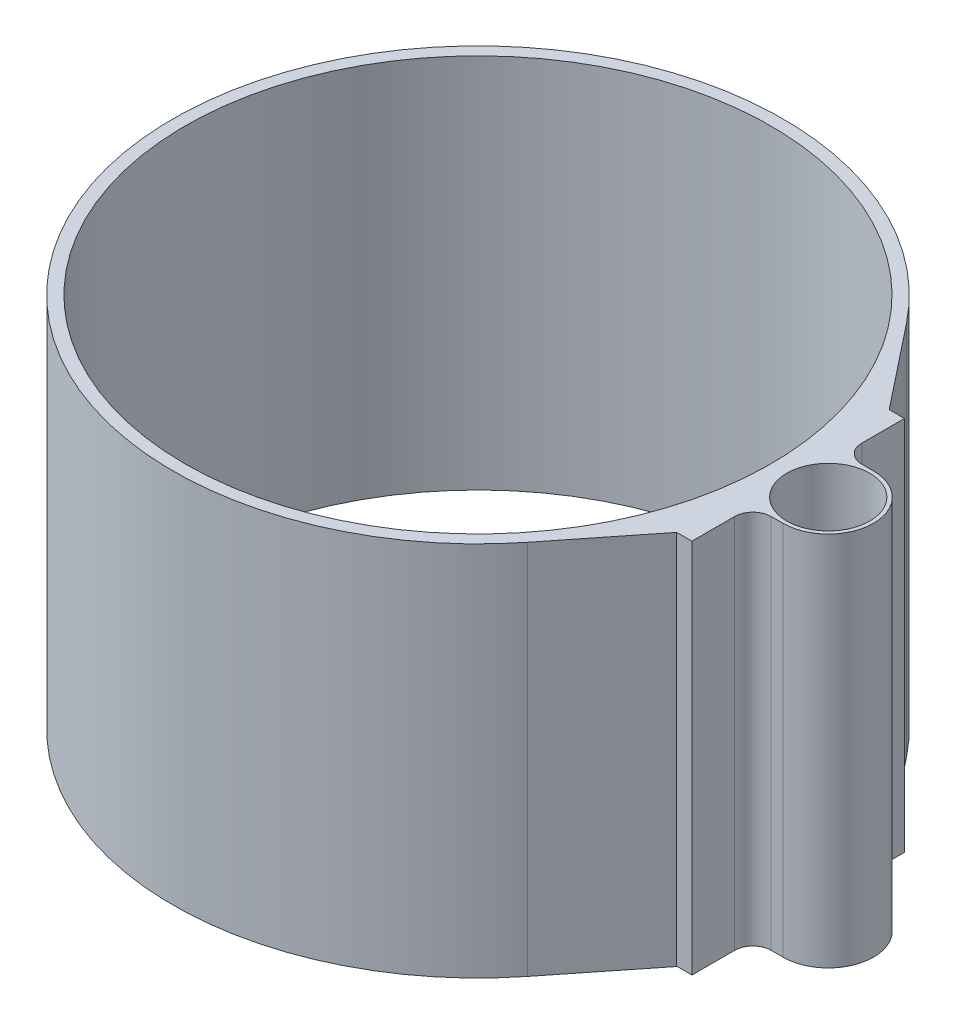
from build123d import *

# Parameters (mm, degrees)
SKETCH1_R                        = 9.42975
SKETCH1_R_2                      = 8.636
BOSS_EXTRUDE1_DEPTH              = 76.2
BOSS_EXTRUDE2_START              = 2.032
SKETCH2_R                        = 9.42975
BOSS_EXTRUDE2_DEPTH              = 2.032
F_10_0_1935_DIAMETER_HOLE1_D     = 4.572
F_10_0_1935_DIAMETER_HOLE1_DEPTH = 6.35
F_10_0_1935_DIAMETER_HOLE1_TIP   = 1.373567375
CUT_EXTRUDE1_DEPTH               = 3.81
CUT_EXTRUDE1_DEPTH_BACK          = 3.81
BOSS_EXTRUDE7_REACH              = 81.064
SKETCH7_W                        = 18.8595
SKETCH7_H                        = 78.232
SKETCH7_10_W                     = 12.7
SKETCH7_10_H                     = 78.232
BOSS_EXTRUDE8_DEPTH              = 3.175
FILLET1_R                        = 3.81
BOSS_EXTRUDE9_START              = -78.282
BOSS_EXTRUDE9_OUTLINE_R          = 60.96
BOSS_EXTRUDE9_DEPTH              = 78.282
CUT_EXTRUDE5_START               = -12.0889291
CUT_EXTRUDE5_DEPTH               = 2.6591791


# Read off the part's stored shape, not the designer's step: Boss-Extrude9, Cut-Extrude5
with BuildPart() as part:
    # Sketch1 → Boss-Extrude1 (new body)
    with BuildSketch(Plane(origin=(0, 0, 0), x_dir=(1, 0, 0), z_dir=(0, 1, 0))):
        with Locations(Location((0, 0, 0), (0, 0, 90))):
            Circle(SKETCH1_R)
        with Locations(Location((0, 0, 0), (0, 0, 90))):
            Circle(SKETCH1_R_2, mode=Mode.SUBTRACT)
    extrude(amount=BOSS_EXTRUDE1_DEPTH)

    # Sketch2 → Boss-Extrude2 (add)
    with BuildSketch(Plane.XZ.offset(BOSS_EXTRUDE2_START)):
        with Locations(Location((0, 0, 0), (0, 0, 270))):
            Circle(SKETCH2_R)
    extrude(amount=-BOSS_EXTRUDE2_DEPTH)

    # #10 (0.1935) Diameter Hole1
    with Locations(Plane(origin=(0, -2.032, 0), x_dir=(-1, 0, 0), z_dir=(0, -1, 0))):
        with Locations((0, 0)):
            Hole(F_10_0_1935_DIAMETER_HOLE1_D / 2, depth=F_10_0_1935_DIAMETER_HOLE1_DEPTH)
            with Locations((0, 0, -(F_10_0_1935_DIAMETER_HOLE1_DEPTH + F_10_0_1935_DIAMETER_HOLE1_TIP / 2))):  # 118° drill point
                Cone(0, F_10_0_1935_DIAMETER_HOLE1_D / 2, F_10_0_1935_DIAMETER_HOLE1_TIP, mode=Mode.SUBTRACT)

    # Sketch6 → Cut-Extrude1 (cut, two sides: drawn at the far end of the back side and taken through both)
    with BuildSketch(Plane.XY.offset(-CUT_EXTRUDE1_DEPTH_BACK)):
        with BuildLine():
            ThreePointArc((-9.42975, 32.512), (-5.87375, 36.068), (-9.42975, 39.624))
            Line((-9.42975, 39.624), (-9.42975, 32.512))
        make_face()
    extrude(amount=CUT_EXTRUDE1_DEPTH + CUT_EXTRUDE1_DEPTH_BACK, mode=Mode.SUBTRACT)

    # Sketch7 → Boss-Extrude7 (add, up to next)
    with BuildSketch(Plane.ZY.offset(9.42975), mode=Mode.PRIVATE) as boss_extrude7_sk1:
        with Locations((0, 37.084)):
            Rectangle(SKETCH7_W, SKETCH7_H)
        with BuildLine():
            add(Edge.make_bspline(
                [(3.81, 39.531923881), (3.209063744, 39.593530356), (2.589122456, 39.610377565), (1.314223657, 39.625889154), (0.653564006, 39.624), (-0.649234164, 39.624), (-1.296863086, 39.625963258), (-2.58430554, 39.610570946), (-3.209529815, 39.593482575), (-3.81, 39.531923881)],
                knots=[0, 0, 0, 0, 0.25, 0.25, 0.5, 0.5, 0.75, 0.75, 1, 1, 1, 1], degree=3))
            Line((3.81, 39.531923881), (3.81, 32.604076119))
            add(Edge.make_bspline(
                [(-3.81, 32.604076119), (-3.209063744, 32.542469644), (-2.589122456, 32.525622435), (-1.314223657, 32.510110846), (-0.653564006, 32.512), (0.649234164, 32.512), (1.296863086, 32.510036742), (2.58430554, 32.525429054), (3.209529815, 32.542517425), (3.81, 32.604076119)],
                knots=[0, 0, 0, 0, 0.25, 0.25, 0.5, 0.5, 0.75, 0.75, 1, 1, 1, 1], degree=3))
            Line((-3.81, 32.604076119), (-3.81, 39.531923881))
        make_face(mode=Mode.SUBTRACT)
    boss_extrude7_tool1 = extrude(boss_extrude7_sk1.sketch, amount=-BOSS_EXTRUDE7_REACH, mode=Mode.PRIVATE) - part.part
    add(boss_extrude7_tool1.solids().sort_by_distance((-9.42975, -1.227269, 0))[0])
    add(boss_extrude7_tool1.solids().sort_by_distance((-9.42975, -1.227269, 0))[1])

    # Sketch7<10> → Boss-Extrude8 (add)
    with BuildSketch(Plane.ZY.offset(9.42975)):
        with Locations((-15.77975, 37.084)):
            Rectangle(SKETCH7_10_W, SKETCH7_10_H)
        with Locations((15.77975, 37.084)):
            Rectangle(SKETCH7_10_W, SKETCH7_10_H)
    extrude(amount=-BOSS_EXTRUDE8_DEPTH)

    # Fillet1
    fillet1_edges = [part.edges().sort_by_distance(p)[0] for p in [
        (-6.25475, 37.084, 9.42975),
        (-6.25475, 37.084, -9.42975),
    ]]
    fillet(fillet1_edges, radius=FILLET1_R)

    # Boss-Extrude9 outline → Boss-Extrude9 (add)
    with BuildSketch(Plane(origin=(0, 76.2, 0), x_dir=(1, 0, 0), z_dir=(0, 1, 0)).offset(BOSS_EXTRUDE9_START)):
        with BuildLine():
            Line((-23.183733507, -39.466236748), (-9.42975, -22.12975))
            Line((-9.42975, -22.12975), (-9.42975, 22.12975))
            Line((-9.42975, 22.12975), (-23.183733507, 39.466236748))
            ThreePointArc((-23.183733507, 39.466236748), (-136.42975, 0), (-23.183733507, -39.466236748))
        make_face()
        with Locations((-72.92975, 0)):
            Circle(BOSS_EXTRUDE9_OUTLINE_R, mode=Mode.SUBTRACT)
    extrude(amount=BOSS_EXTRUDE9_DEPTH)

    # Cut-Extrude5 outline → Cut-Extrude5 (cut)
    with BuildSketch(Plane(origin=(0, 0, 0), x_dir=(0, 0, -1), z_dir=(1, 0, 0)).offset(CUT_EXTRUDE5_START)):
        with BuildLine():
            Line((3.81, 32.933676012), (3.81, 39.202323988))
            add(Edge.make_bspline(
                [(3.81, 39.202323988), (3.518648392, 39.279078334), (3.214598323, 39.335686025), (2.596807012, 39.422172204), (2.282372763, 39.452317221), (1.643247367, 39.496969319), (1.3185544, 39.511420765), (0.659044279, 39.530145261), (0.326972294, 39.534304508), (-0.332604892, 39.534255253), (-0.661519368, 39.5300831), (-1.317571239, 39.51144055), (-1.646658119, 39.496824503), (-2.611094156, 39.429162016), (-3.226748456, 39.355977132), (-3.81, 39.202323988)],
                knots=[0, 0, 0, 0, 0.125, 0.125, 0.25, 0.25, 0.375, 0.375, 0.5, 0.5, 0.625, 0.625, 0.75, 0.75, 1, 1, 1, 1], degree=3))
            Line((-3.81, 39.202323988), (-3.81, 32.933676012))
            add(Edge.make_bspline(
                [(-3.81, 32.933676012), (-3.518648392, 32.856921666), (-3.214598323, 32.800313975), (-2.596807012, 32.713827796), (-2.282372763, 32.683682779), (-1.643247367, 32.639030681), (-1.3185544, 32.624579235), (-0.659044279, 32.605854739), (-0.326972294, 32.601695492), (0.332604892, 32.601744747), (0.661519368, 32.6059169), (1.317571239, 32.62455945), (1.646658119, 32.639175497), (2.611094156, 32.706837984), (3.226748456, 32.780022868), (3.81, 32.933676012)],
                knots=[0, 0, 0, 0, 0.125, 0.125, 0.25, 0.25, 0.375, 0.375, 0.5, 0.5, 0.625, 0.625, 0.75, 0.75, 1, 1, 1, 1], degree=3))
        make_face()
    extrude(amount=CUT_EXTRUDE5_DEPTH, mode=Mode.SUBTRACT)


solid = part.part
